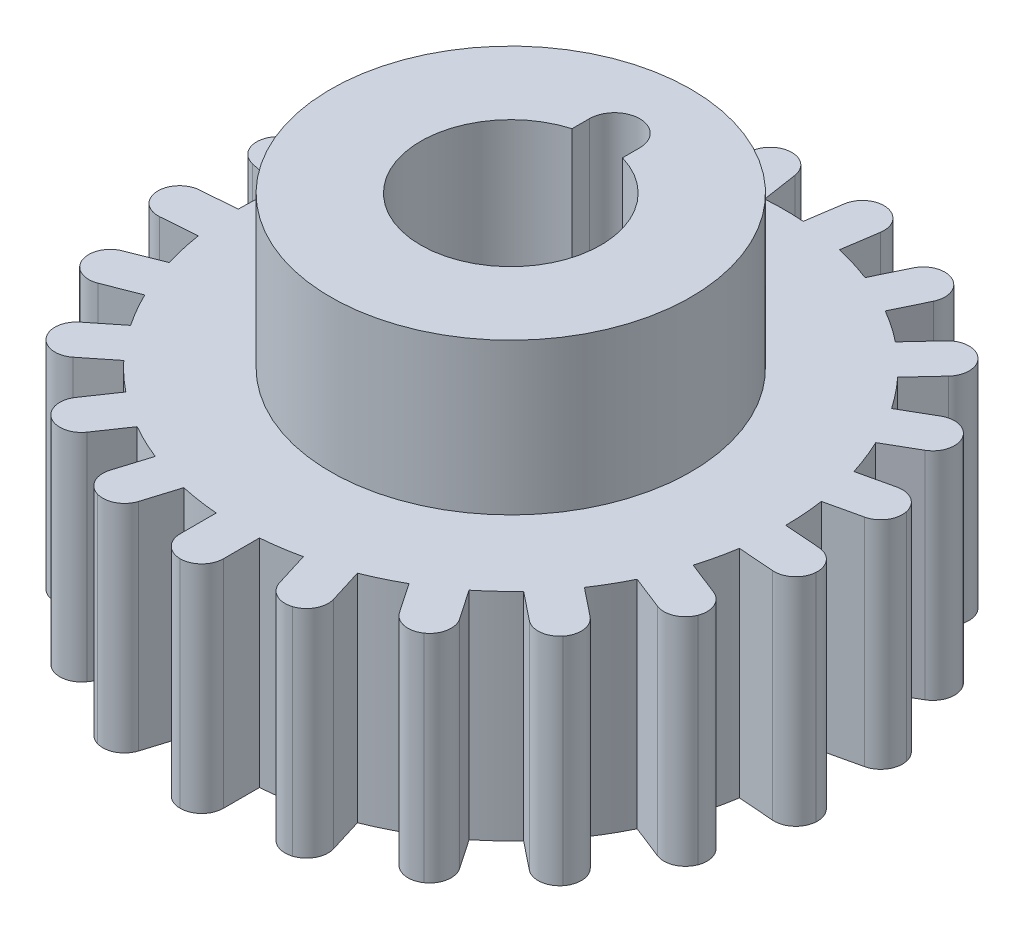
from build123d import *

# Parameters (mm, degrees)
SKETCH_1_R                       = 76
EXTRUDE_1_DEPTH                  = 60
SKETCH_2_R                       = 50
EXTRUDE_2_DEPTH                  = 42
CUT_EXTRUDE_1_DEPTH              = 149.175571536
SKETCH_4_R                       = 7
CUT_EXTRUDE_2_DEPTH              = 149.175571536
EXTRUDE_3_DEPTH                  = 60
FILLET_1_R                       = 6
PATTERN_CIRCULAR_1_COUNT         = 21
FILLET_1_OF_PATTERN_CIRCULAR_1_R = 6


with BuildPart() as part:
    # 草图1 → 凸台-拉伸1 (new body)
    with BuildSketch(Plane(origin=(0, 0, 0), x_dir=(1, 0, 0), z_dir=(0, 1, 0))):
        with Locations(Location((0, 0, 0), (0, 0, 270))):
            Circle(SKETCH_1_R)
    extrude(amount=EXTRUDE_1_DEPTH)

    # 草图2 → 凸台-拉伸2 (add)
    with BuildSketch(Plane(origin=(0, 60, 0), x_dir=(1, 0, 0), z_dir=(0, 1, 0))):
        with Locations(Location((0, 0, 0), (0, 0, 90))):
            Circle(SKETCH_2_R)
    extrude(amount=EXTRUDE_2_DEPTH)

    # 草图3 → 切除-拉伸1 (cut, through all)
    with BuildSketch(Plane(origin=(0, 102, 0), x_dir=(1, 0, 0), z_dir=(0, 1, 0))):
        with BuildLine():
            Line((-7, 24), (-7, 28.8))
            Line((-7, 28.8), (7, 28.8))
            Line((7, 28.8), (7, 24))
            ThreePointArc((7, 24), (0, -25), (-7, 24))
        make_face()
    extrude(amount=-CUT_EXTRUDE_1_DEPTH, mode=Mode.SUBTRACT)

    # 草图4 → 切除-拉伸2 (cut, through all)
    with BuildSketch(Plane(origin=(0, 102, 0), x_dir=(1, 0, 0), z_dir=(0, 1, 0))):
        with Locations((0, 28.8)):
            Circle(SKETCH_4_R)
    extrude(amount=-CUT_EXTRUDE_2_DEPTH, mode=Mode.SUBTRACT)

    # 草图5 → 凸台-拉伸3 (add)
    with BuildSketch(Plane(origin=(0, 0, 0), x_dir=(-1, 0, 0), z_dir=(0, -1, 0))):
        with BuildLine():
            Line((6, -75.7627877), (6, -91.7627877))
            Line((6, -91.7627877), (-6, -91.7627877))
            Line((-6, -91.7627877), (-6, -75.7627877))
            ThreePointArc((-6, -75.7627877), (0, -76), (6, -75.7627877))
        make_face()
    extrude_3 = extrude(amount=-EXTRUDE_3_DEPTH)

    # 圆角1
    fillet_1_edges = [part.edges().sort_by_distance(p)[0] for p in [
        (-6, 30, 91.7627877),
        (6, 30, 91.7627877),
    ]]
    fillet(fillet_1_edges, radius=FILLET_1_R - 0.0001)  # a hair under: the kernel refuses the full size

    # 阵列(圆周)1: 凸台-拉伸3 ×21 about axis
    pattern_circular_1_axis = Axis((0, 0, 0), (0, 1, 0))
    for i in range(1, PATTERN_CIRCULAR_1_COUNT):
        add(extrude_3.rotate(pattern_circular_1_axis, i * 360 / PATTERN_CIRCULAR_1_COUNT))

    # 圆角1 of 阵列(圆周)1
    fillet_1_of_pattern_circular_1_edges = [part.edges().sort_by_distance(p)[0] for p in [
        (21.314119658, 30, 89.454555555),
        (32.780993328, 30, 85.917493462),
        (46.734386249, 30, 79.197893585),
        (56.649251541, 30, 72.438052888),
        (68.002097531, 30, 61.904151216),
        (75.483975154, 30, 52.522173426),
        (83.227524026, 30, 39.109953349),
        (87.611616318, 30, 27.939468365),
        (91.057819772, 30, 12.840664496),
        (91.954580895, 30, 0.874218929),
        (90.797228632, 30, -14.569573748),
        (88.126977424, 30, -26.268708694),
        (82.46890527, 30, -40.685241427),
        (76.46890527, 30, -51.077546272),
        (66.812857766, 30, -63.185846861),
        (58.016235304, 30, -71.347919714),
        (45.220194646, 30, -80.072112514),
        (34.408568231, 30, -85.278717384),
        (19.609518787, 30, -89.843619581),
        (7.743548872, 30, -91.632126775),
        (-7.743548872, 30, -91.632126775),
        (-19.609518787, 30, -89.843619581),
        (-34.408568231, 30, -85.278717384),
        (-45.220194646, 30, -80.072112514),
        (-58.016235304, 30, -71.347919714),
        (-66.812857766, 30, -63.185846861),
        (-76.46890527, 30, -51.077546272),
        (-82.46890527, 30, -40.685241427),
        (-88.126977424, 30, -26.268708694),
        (-90.797228632, 30, -14.569573748),
        (-91.954580895, 30, 0.874218929),
        (-91.057819772, 30, 12.840664496),
        (-87.611616318, 30, 27.939468365),
        (-83.227524026, 30, 39.109953349),
        (-75.483975154, 30, 52.522173426),
        (-68.002097531, 30, 61.904151216),
        (-56.649251541, 30, 72.438052888),
        (-46.734386249, 30, 79.197893585),
        (-32.780993328, 30, 85.917493462),
        (-21.314119658, 30, 89.454555555),
    ]]
    fillet(fillet_1_of_pattern_circular_1_edges, radius=FILLET_1_OF_PATTERN_CIRCULAR_1_R - 0.0001)  # a hair under: the kernel refuses the full size


solid = part.part
